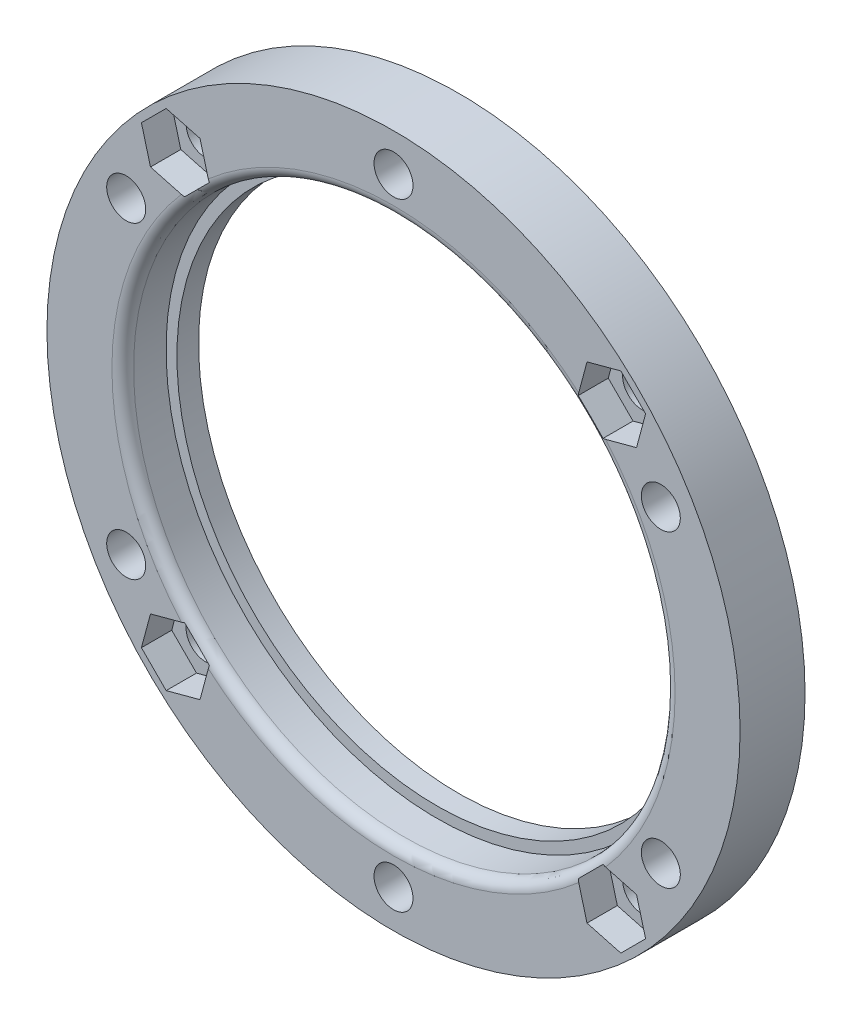
from build123d import *

# Parameters (mm, degrees)
SKETCH_1_R          = 32
SKETCH_1_R_2        = 24
EXTRUDE_1_DEPTH     = 2
SKETCH_2_R          = 32
SKETCH_2_R_2        = 25
EXTRUDE_2_DEPTH     = 4
SKETCH_3_R          = 1.8
CUT_EXTRUDE_1_DEPTH = 46.650848842
CUT_EXTRUDE_2_DEPTH = 2.8
SKETCH_6_R          = 1.8
CUT_EXTRUDE_3_DEPTH = 46.367830012
CUT_EXTRUDE_4_DEPTH = 2.8
FILLET_1_R          = 1


with BuildPart() as part:
    # 草图1 → 凸台-拉伸1 (new body)
    with BuildSketch(Plane.XY):
        Circle(SKETCH_1_R)
        Circle(SKETCH_1_R_2, mode=Mode.SUBTRACT)
    extrude(amount=EXTRUDE_1_DEPTH)

    # 草图2 → 凸台-拉伸2 (add)
    with BuildSketch(Plane.XY.offset(2)):
        Circle(SKETCH_2_R)
        Circle(SKETCH_2_R_2, mode=Mode.SUBTRACT)
    extrude(amount=EXTRUDE_2_DEPTH)

    # 草图3 → 切除-拉伸1 (cut, through all)
    with BuildSketch(Plane.XY.offset(6)):
        with Locations((0, 28.5)):
            Circle(SKETCH_3_R)
        with Locations((24.681724008, 14.25)):
            Circle(SKETCH_3_R)
        with Locations((24.681724008, -14.25)):
            Circle(SKETCH_3_R)
        with Locations((0, -28.5)):
            Circle(SKETCH_3_R)
        with Locations((-24.681724008, -14.25)):
            Circle(SKETCH_3_R)
        with Locations((-24.681724008, 14.25)):
            Circle(SKETCH_3_R)
    extrude(amount=-CUT_EXTRUDE_1_DEPTH, mode=Mode.SUBTRACT)

    # 草图5 → 切除-拉伸2 (cut)
    with BuildSketch(Plane.XY.offset(6)):
        Polygon((-17.866352837, 22.43873369), (-20.989347038, 23.275537464), (-23.275537464, 20.989347038), (-22.43873369, 17.866352837), (-19.31573949, 17.029549063), (-17.029549063, 19.31573949), align=None)
        Polygon((22.43873369, 17.866352837), (23.275537464, 20.989347038), (20.989347038, 23.275537464), (17.866352837, 22.43873369), (17.029549063, 19.31573949), (19.31573949, 17.029549063), align=None)
        Polygon((17.866352837, -22.43873369), (20.989347038, -23.275537464), (23.275537464, -20.989347038), (22.43873369, -17.866352837), (19.31573949, -17.029549063), (17.029549063, -19.31573949), align=None)
        Polygon((-22.43873369, -17.866352837), (-23.275537464, -20.989347038), (-20.989347038, -23.275537464), (-17.866352837, -22.43873369), (-17.029549063, -19.31573949), (-19.31573949, -17.029549063), align=None)
    extrude(amount=-CUT_EXTRUDE_2_DEPTH, mode=Mode.SUBTRACT)

    # 草图6 → 切除-拉伸3 (cut, through all)
    with BuildSketch(Plane.XY.offset(3.2)):
        with Locations((-20.152543264, 20.152543264)):
            Circle(SKETCH_6_R)
        with Locations((20.152543264, 20.152543264)):
            Circle(SKETCH_6_R)
        with Locations((20.152543264, -20.152543264)):
            Circle(SKETCH_6_R)
        with Locations((-20.152543264, -20.152543264)):
            Circle(SKETCH_6_R)
    extrude(amount=-CUT_EXTRUDE_3_DEPTH, mode=Mode.SUBTRACT)

    # 草图7 → 切除-拉伸4 (cut)
    with BuildSketch(Plane(origin=(0, 0, 0), x_dir=(-1, 0, 0), z_dir=(0, 0, -1))):
        Polygon((3.233161507, 28.5), (1.616580754, 31.3), (-1.616580754, 31.3), (-3.233161507, 28.5), (-1.616580754, 25.7), (1.616580754, 25.7), align=None)
        Polygon((26.298304762, 11.45), (27.914885515, 14.25), (26.298304762, 17.05), (23.065143254, 17.05), (21.4485625, 14.25), (23.065143254, 11.45), align=None)
        Polygon((23.065143254, -17.05), (26.298304762, -17.05), (27.914885515, -14.25), (26.298304762, -11.45), (23.065143254, -11.45), (21.4485625, -14.25), align=None)
        Polygon((-3.233161507, -28.5), (-1.616580754, -31.3), (1.616580754, -31.3), (3.233161507, -28.5), (1.616580754, -25.7), (-1.616580754, -25.7), align=None)
        Polygon((-26.298304762, -11.45), (-27.914885515, -14.25), (-26.298304762, -17.05), (-23.065143254, -17.05), (-21.4485625, -14.25), (-23.065143254, -11.45), align=None)
        Polygon((-23.065143254, 17.05), (-26.298304762, 17.05), (-27.914885515, 14.25), (-26.298304762, 11.45), (-23.065143254, 11.45), (-21.4485625, 14.25), align=None)
    extrude(amount=-CUT_EXTRUDE_4_DEPTH, mode=Mode.SUBTRACT)

    # 圆角1
    # the kernel refuses this fillet: 1 mm, written as the material it takes off along each edge
    with BuildSketch(Plane(origin=(0, 0, 6), x_dir=(1, 0, 0), z_dir=(0, -1, 0))) as fillet_1_piece_1:
        with BuildLine():
            CenterArc((25 + FILLET_1_R, -FILLET_1_R), FILLET_1_R, 90, 90)
            Line((25, -FILLET_1_R), (25, 0))
            Line((25, 0), (25 + FILLET_1_R, 0))
        make_face()
    revolve(axis=Axis((0, 0, 6), (0, 0, 1)), mode=Mode.SUBTRACT)


solid = part.part
